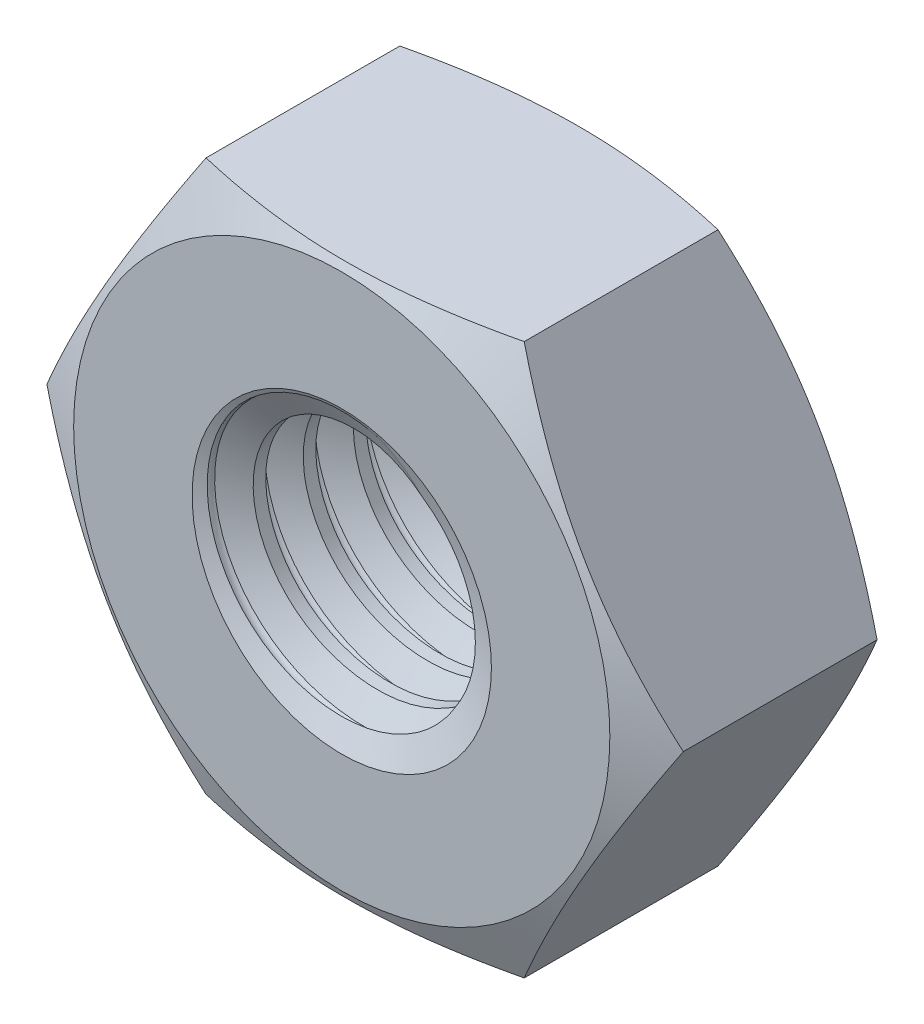
from build123d import *

# Parameters (mm, degrees)
SKETCH1_R           = 1.1935
BOSS_EXTRUDE2_DEPTH = 2.4
CHAMFER1_SIZE       = 0.5
CHAMFER1_SIZE2      = 0.233153829
CHAMFER2_SIZE       = 0.5
CHAMFER2_SIZE2      = 0.233153829
SKETCH1_4_OUTSIDE_W = 10.21
SKETCH1_4_OUTSIDE_H = 10.21
CUT_EXTRUDE1_DEPTH  = 2.4
CHAMFER3_SIZE       = 0.3
CHAMFER3_SIZE2      = 0.139892297
CHAMFER4_SIZE       = 0.3
CHAMFER4_SIZE2      = 0.139892297
CUT_SWEEP2_PITCH    = 0.5


with BuildPart() as part:
    # Sketch1 → Boss-Extrude2 (new body)
    # profile 1 of 7: a face of its own
    with BuildSketch(Plane.XY):
        Polygon((-3.175426481, 0), (-1.58771324, 2.75), (1.58771324, 2.75), (3.175426481, 0), (1.58771324, -2.75), (-1.58771324, -2.75), align=None)
        Circle(SKETCH1_R, mode=Mode.SUBTRACT)
    # profile 2 of 7: a face of its own
    with BuildSketch(Plane.XY):
        with BuildLine():
            Line((-3.175426481, 0), (-1.58771324, 2.75))
            ThreePointArc((-1.58771324, 2.75), (-2.75, 1.58771324), (-3.175426481, 0))
        make_face()
    # profile 3 of 7: a face of its own
    with BuildSketch(Plane.XY):
        with BuildLine():
            ThreePointArc((1.58771324, 2.75), (0, 3.175426481), (-1.58771324, 2.75))
            Line((-1.58771324, 2.75), (1.58771324, 2.75))
        make_face()
    # profile 4 of 7: a face of its own
    with BuildSketch(Plane.XY):
        with BuildLine():
            ThreePointArc((3.175426481, 0), (2.75, 1.58771324), (1.58771324, 2.75))
            Line((1.58771324, 2.75), (3.175426481, 0))
        make_face()
    # profile 5 of 7: a face of its own
    with BuildSketch(Plane.XY):
        with BuildLine():
            ThreePointArc((1.58771324, -2.75), (2.75, -1.58771324), (3.175426481, 0))
            Line((3.175426481, 0), (1.58771324, -2.75))
        make_face()
    # profile 6 of 7: a face of its own
    with BuildSketch(Plane.XY):
        with BuildLine():
            Line((-1.58771324, -2.75), (-3.175426481, 0))
            ThreePointArc((-3.175426481, 0), (-2.75, -1.58771324), (-1.58771324, -2.75))
        make_face()
    # profile 7 of 7: a face of its own
    with BuildSketch(Plane.XY):
        with BuildLine():
            Line((1.58771324, -2.75), (-1.58771324, -2.75))
            ThreePointArc((-1.58771324, -2.75), (0, -3.175426481), (1.58771324, -2.75))
        make_face()
    extrude(amount=-BOSS_EXTRUDE2_DEPTH)

    # Chamfer1
    chamfer1_edges = [part.edges().sort_by_distance(p)[0] for p in [
        (1.58771324, 2.75, -2.4),
    ]]
    chamfer1_side = [part.faces().sort_by_distance(p)[0] for p in [
        (1.542805928, 2.672218254, -2.4),
    ]]
    chamfer(chamfer1_edges, length=CHAMFER1_SIZE, length2=CHAMFER1_SIZE2, reference=chamfer1_side[0])

    # Chamfer2
    chamfer2_edges = [part.edges().sort_by_distance(p)[0] for p in [
        (1.58771324, 2.75, 0),
    ]]
    chamfer2_side = [part.faces().sort_by_distance(p)[0] for p in [
        (1.542805928, 2.672218254, 0),
    ]]
    chamfer(chamfer2_edges, length=CHAMFER2_SIZE, length2=CHAMFER2_SIZE2, reference=chamfer2_side[0])

    # Sketch1<4> outside → Cut-Extrude1 (cut)
    with BuildSketch(Plane.XY):
        Rectangle(SKETCH1_4_OUTSIDE_W, SKETCH1_4_OUTSIDE_H)
        Polygon((-1.58771324, 2.75), (1.58771324, 2.75), (3.175426481, 0), (1.58771324, -2.75), (-1.58771324, -2.75), (-3.175426481, 0), align=None, mode=Mode.SUBTRACT)
    extrude(amount=-CUT_EXTRUDE1_DEPTH, mode=Mode.SUBTRACT)

    # Chamfer3
    chamfer3_edges = [part.edges().sort_by_distance(p)[0] for p in [
        (-1.1935, 0, 0),
    ]]
    chamfer3_side = [part.faces().sort_by_distance(p)[0] for p in [
        (1.299876996, 2.251453001, 0),
    ]]
    chamfer(chamfer3_edges, length=CHAMFER3_SIZE, length2=CHAMFER3_SIZE2, reference=chamfer3_side[0])

    # Chamfer4
    chamfer4_edges = [part.edges().sort_by_distance(p)[0] for p in [
        (-1.1935, 0, -2.4),
    ]]
    chamfer4_side = [part.faces().sort_by_distance(p)[0] for p in [
        (1.299876996, 2.251453001, -2.4),
    ]]
    chamfer(chamfer4_edges, length=CHAMFER4_SIZE, length2=CHAMFER4_SIZE2, reference=chamfer4_side[0])

    # Cut-Sweep2: the profile of Sketch6 profile screwed along a left-hand helix of 8 turns, 6 arcs to a turn; built about Z, then put on its axis
    cut_sweep2_z = Axis((0, 0, 0), (0, 0, 1))
    cut_sweep2_corners = [(1.1932, 0, -0.187675038), (1.437644378, 0, -0.046545011), (1.458187789, 0, 0), (1.437644378, 0, 0.046545011), (1.1932, 0, 0.187675038)]
    with BuildLine(mode=Mode.PRIVATE) as cut_sweep2_profile:
        Line(cut_sweep2_corners[0], cut_sweep2_corners[1])
        Line(cut_sweep2_corners[3], cut_sweep2_corners[4])
        Line(cut_sweep2_corners[4], cut_sweep2_corners[0])
        ThreePointArc((1.437644378, 0, -0.046545011), (1.452823564, 0, -0.025438503), (1.458187789, 0, 0))
        ThreePointArc((1.458187789, 0, 0), (1.452823564, 0, 0.025438503), (1.437644378, 0, 0.046545011))
    cut_sweep2_cap = Face(cut_sweep2_profile.wire())
    cut_sweep2_arcs = [((1.437644378, 0, -0.046545011), (1.458187789, 0, -0.027806093), (1.458187789, 0, 0), (1, 0.9148535712846794, 1)), ((1.458187789, 0, 0), (1.458187789, 0, 0.027806093), (1.437644378, 0, 0.046545011), (1, 0.9148535712846794, 1))]  # start, shoulder, end, weights
    cut_sweep2_turn_angles = [0, -30, -60, -90, -120, -150, -180, -210, -240, -270, -300, -330, -360]
    cut_sweep2_turn_weights = [1, 0.8660254037844387, 1, 0.8660254037844387, 1, 0.8660254037844387, 1, 0.8660254037844387, 1, 0.8660254037844387, 1, 0.8660254037844387, 1]
    cut_sweep2_turn_rails = [Edge.make_bspline([Vector(p[0], p[1], 0).rotate(cut_sweep2_z, cut_sweep2_turn_angles[k]) / cut_sweep2_turn_weights[k] + Vector(0, 0, p[2] + -CUT_SWEEP2_PITCH * cut_sweep2_turn_angles[k] / 360) for k in range(13)], [0, 0, 0, 1, 1, 2, 2, 3, 3, 4, 4, 5, 5, 6, 6, 6], 2, cut_sweep2_turn_weights) for p in cut_sweep2_corners]
    cut_sweep2_turn_sides = [*[Face.make_surface_from_curves(cut_sweep2_turn_rails[p[0]], cut_sweep2_turn_rails[p[1]]) for p in [(0, 1), (3, 4), (4, 0)]], *[Face.make_bezier_surface([[Vector(p[j][0], p[j][1], 0).rotate(cut_sweep2_z, cut_sweep2_turn_angles[2 * i + k]) / cut_sweep2_turn_weights[2 * i + k] + Vector(0, 0, p[j][2] + -CUT_SWEEP2_PITCH * cut_sweep2_turn_angles[2 * i + k] / 360) for k in range(3)] for j in range(3)], [[p[3][j] * cut_sweep2_turn_weights[2 * i + k] for k in range(3)] for j in range(3)]) for p in cut_sweep2_arcs for i in range(6)]]
    cut_sweep2 = Plane(origin=(0, 0, 1), x_dir=(0, 1, 0), z_dir=(0, 0, -1)) * Solid(Shell([*[p.moved(Location((0, 0, CUT_SWEEP2_PITCH * i))) for i in range(8) for p in cut_sweep2_turn_sides], cut_sweep2_cap, cut_sweep2_cap.rotate(cut_sweep2_z, -2880).moved(Location((0, 0, -CUT_SWEEP2_PITCH * -2880 / 360)))]))
    add(cut_sweep2, mode=Mode.SUBTRACT)


solid = part.part
